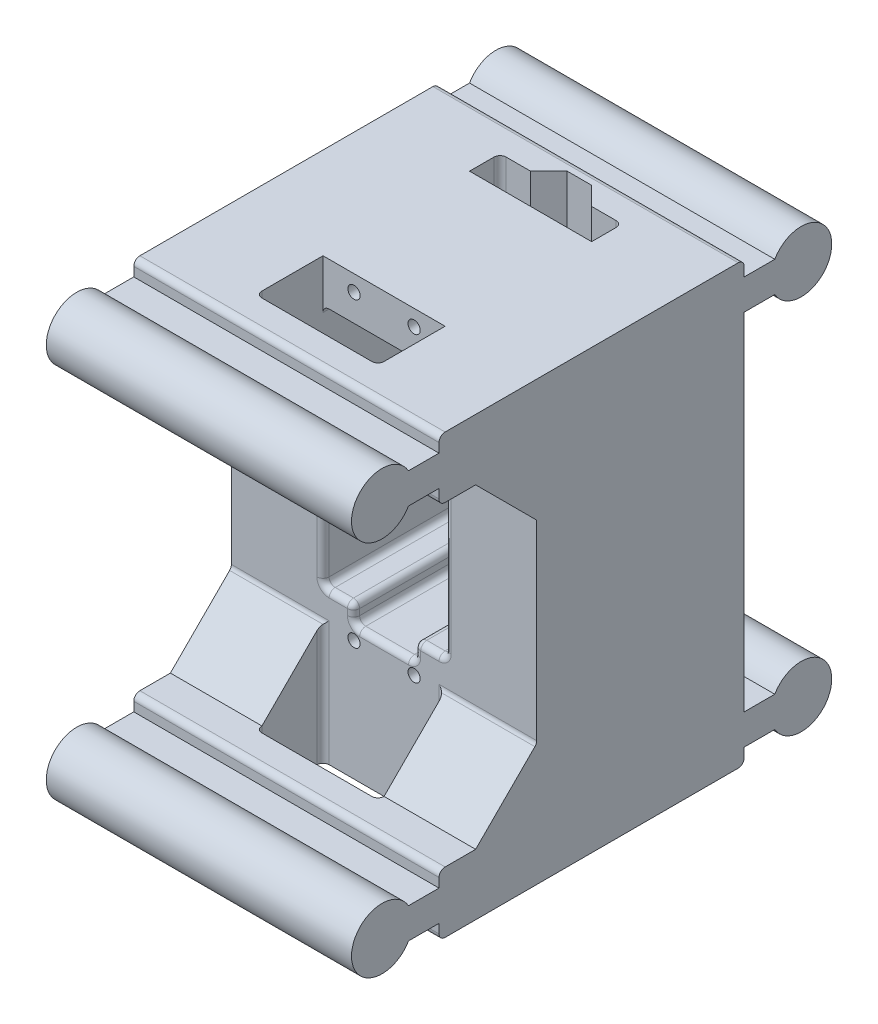
from build123d import *

# Parameters (mm, degrees)
ESBO_O2_W                = 20
ESBO_O2_H                = 40
RESSALTO_EXTRUS_O2_DEPTH = 29
ESBO_O3_W                = 15
ESBO_O3_H                = 10
RESSALTO_EXTRUS_O3_DEPTH = 16
ESBO_O4_W                = 5
ESBO_O4_H                = 10
RESSALTO_EXTRUS_O4_DEPTH = 20
ESBO_O5_W                = 50
ESBO_O5_H                = 71.7
RESSALTO_EXTRUS_O5_DEPTH = 5
RESSALTO_EXTRUS_O6_DEPTH = 50
ESBO_O9_W                = 10
ESBO_O9_H                = 6
CORTE_EXTRUS_O1_DEPTH    = 29
ESBO_O10_W               = 20
ESBO_O10_H               = 5
CORTE_EXTRUS_O2_DEPTH    = 7.05
ESBO_O11_W               = 10
ESBO_O11_H               = 50.05
CORTE_EXTRUS_O3_DEPTH    = 3
CHANFRO4_SIZE            = 3
ESBO_O12_R               = 1
CORTE_EXTRUS_O4_DEPTH    = 10
CHANFRO5_SIZE            = 10
FILETE2_R                = 1
ESBO_O19_R               = 2.05
CORTE_EXTRUS_O7_DEPTH    = 10


with BuildPart() as part:
    # Esboço2 → Ressalto-extrusão2 (new body)
    with BuildSketch(Plane.XY):
        Polygon((25, 0), (25, 7.05), (-25, 7.05), (-25, 0), (-25, -40), (-25, -64.65), (25, -64.65), (25, -40), align=None)
        with Locations((0, -20)):
            Rectangle(ESBO_O2_W, ESBO_O2_H, mode=Mode.SUBTRACT)
    extrude(amount=-RESSALTO_EXTRUS_O2_DEPTH)

    # Esboço3 → Ressalto-extrusão3 (add)
    with BuildSketch(Plane.XY):
        with Locations((17.5, 2.05)):
            Rectangle(ESBO_O3_W, ESBO_O3_H)
        with Locations((-17.5, 2.05)):
            Rectangle(ESBO_O3_W, ESBO_O3_H)
    ressalto_extrus_o3 = extrude(amount=RESSALTO_EXTRUS_O3_DEPTH)

    # Esboço4 → Ressalto-extrusão4 (add)
    with BuildSketch(Plane.ZY.offset(-10)):
        with Locations((13.5, 2.05)):
            Rectangle(ESBO_O4_W, ESBO_O4_H)
    ressalto_extrus_o4 = extrude(amount=RESSALTO_EXTRUS_O4_DEPTH)

    # Esboço5 → Ressalto-extrusão5 (add)
    with BuildSketch(Plane(origin=(0, 0, -29), x_dir=(-1, 0, 0), z_dir=(0, 0, -1))):
        with Locations((0, -28.8)):
            Rectangle(ESBO_O5_W, ESBO_O5_H)
    extrude(amount=RESSALTO_EXTRUS_O5_DEPTH)

    # Esboço6 → Ressalto-extrusão6 (add)
    with BuildSketch(Plane.ZY.offset(25)):
        with BuildLine():
            Line((16, 4.55), (21, 4.55))
            ThreePointArc((21, 4.55), (30.330127019, 2.05), (21, -0.45))
            Line((21, -0.45), (16, -0.45))
            Line((16, -0.45), (16, 4.55))
        make_face()
        with BuildLine():
            Line((-34, 4.55), (-34, -0.45))
            Line((-34, -0.45), (-39, -0.45))
            ThreePointArc((-39, -0.45), (-48.330127019, 2.05), (-39, 4.55))
            Line((-39, 4.55), (-34, 4.55))
        make_face()
    ressalto_extrus_o6 = extrude(amount=-RESSALTO_EXTRUS_O6_DEPTH)

    # Espelhar2: Ressalto-extrusão3, Ressalto-extrusão4, Ressalto-extrusão6 across plane
    add(ressalto_extrus_o3.mirror(Plane(origin=(0, -28.8, 0), x_dir=(0, 0, 1), z_dir=(0, -1, 0))))
    add(ressalto_extrus_o4.mirror(Plane(origin=(0, -28.8, 0), x_dir=(0, 0, 1), z_dir=(0, -1, 0))))
    add(ressalto_extrus_o6.mirror(Plane(origin=(0, -28.8, 0), x_dir=(0, 0, 1), z_dir=(0, -1, 0))))

    # Esboço9 → Corte-extrusão1 (cut)
    with BuildSketch(Plane.XY):
        with Locations((0, -40)):
            Rectangle(ESBO_O9_W, ESBO_O9_H)
    extrude(amount=-CORTE_EXTRUS_O1_DEPTH, mode=Mode.SUBTRACT)

    # Esboço10 → Corte-extrusão2 (cut)
    with BuildSketch(Plane.XZ):
        with Locations((0, -26.5)):
            Rectangle(ESBO_O10_W, ESBO_O10_H)
    extrude(amount=-CORTE_EXTRUS_O2_DEPTH, mode=Mode.SUBTRACT)

    # Esboço11 → Corte-extrusão3 (cut)
    with BuildSketch(Plane.XY.offset(-29)):
        with Locations((0, -17.975)):
            Rectangle(ESBO_O11_W, ESBO_O11_H)
    extrude(amount=-CORTE_EXTRUS_O3_DEPTH, mode=Mode.SUBTRACT)

    # Chanfro4
    chanfro4_edges = [part.edges().sort_by_distance(p)[0] for p in [
        (-5, -17.975, -32),
        (5, -17.975, -32),
    ]]
    chamfer(chanfro4_edges, length=CHANFRO4_SIZE)

    # Esboço12 → Corte-extrusão4 (cut)
    with BuildSketch(Plane.XY):
        with Locations((-4.925, 4.42)):
            Circle(ESBO_O12_R)
        with Locations((4.925, 4.42)):
            Circle(ESBO_O12_R)
        with Locations((4.925, -45)):
            Circle(ESBO_O12_R)
        with Locations((-4.925, -45)):
            Circle(ESBO_O12_R)
    extrude(amount=-CORTE_EXTRUS_O4_DEPTH, mode=Mode.SUBTRACT)

    # Chanfro5
    chanfro5_edges = [part.edges().sort_by_distance(p)[0] for p in [
        (17.5, -54.65, 0),
        (-17.5, -54.65, 0),
        (17.5, -2.95, 0),
        (-17.5, -2.95, 0),
    ]]
    chamfer(chanfro5_edges, length=CHANFRO5_SIZE)

    # Filete2
    # the kernel refuses this fillet: 1 mm, written as the material it adds along each edge
    with BuildSketch(Plane(origin=(10, -64.65, 0), x_dir=(0, 0, 1), z_dir=(0, 1, 0))) as filete2_piece_1_section:
        with BuildLine():
            CenterArc((FILETE2_R, -FILETE2_R), FILETE2_R, 90, 90)
            Line((0, -FILETE2_R), (0, 0))
            Line((0, 0), (FILETE2_R, 0))
        make_face()
    filete2_piece_1 = extrude(amount=22.5, mode=Mode.PRIVATE)
    filete2_piece_1 = split(filete2_piece_1, bisect_by=Plane(origin=(9.772216332, -49.818033507, 5.168033507), z_dir=(0, -0.7071067811865476, -0.7071067811865476)), keep=Keep.TOP, mode=Mode.PRIVATE)
    add(filete2_piece_1)
    with BuildSketch(Plane(origin=(-10, -42.15, 0), x_dir=(0, 0, 1), z_dir=(0, -1, 0))) as filete2_piece_2_section:
        with BuildLine():
            CenterArc((FILETE2_R, -FILETE2_R), FILETE2_R, 90, 90)
            Line((0, -FILETE2_R), (0, 0))
            Line((0, 0), (FILETE2_R, 0))
        make_face()
    filete2_piece_2 = extrude(amount=22.5, mode=Mode.PRIVATE)
    filete2_piece_2 = split(filete2_piece_2, bisect_by=Plane(origin=(-9.772216332, -49.818033507, 5.168033507), z_dir=(0, -0.7071067811865476, -0.7071067811865476)), keep=Keep.TOP, mode=Mode.PRIVATE)
    add(filete2_piece_2)
    with BuildSketch(Plane(origin=(10, -64.65, 11), x_dir=(0, 0, -1), z_dir=(0, 1, 0)), Plane(origin=(-10, -64.65, 11), x_dir=(1, 0, 0), z_dir=(0, 1, 0)), Plane(origin=(-10, 7.05, 11), x_dir=(0, 0, -1), z_dir=(0, -1, 0))) as filete2_piece_3:
        with BuildLine():
            CenterArc((FILETE2_R, FILETE2_R), FILETE2_R, 180, 90)
            Line((0, FILETE2_R), (0, 0))
            Line((0, 0), (FILETE2_R, 0))
        make_face()
    extrude(amount=10)
    with BuildSketch(Plane(origin=(-10, 0, 0), x_dir=(1, 0, 0), z_dir=(0, 0, -1)), Plane(origin=(10, 0, 0), x_dir=(0, -1, 0), z_dir=(0, 0, -1))) as filete2_piece_4:
        with BuildLine():
            CenterArc((FILETE2_R, FILETE2_R), FILETE2_R, 180, 90)
            Line((0, FILETE2_R), (0, 0))
            Line((0, 0), (FILETE2_R, 0))
        make_face()
    extrude(amount=24)
    with BuildSketch(Plane(origin=(5, -43, 0), x_dir=(0, 1, 0), z_dir=(0, 0, -1)), Plane(origin=(-5, -43, 0), x_dir=(1, 0, 0), z_dir=(0, 0, -1)), Plane(origin=(10, -40, 0), x_dir=(0, 1, 0), z_dir=(0, 0, -1))) as filete2_piece_5:
        with BuildLine():
            CenterArc((FILETE2_R, -FILETE2_R), FILETE2_R, 90, 90)
            Line((0, -FILETE2_R), (0, 0))
            Line((0, 0), (FILETE2_R, 0))
        make_face()
    extrude(amount=31.5)
    with BuildSketch(Plane(origin=(10, 7.05, -29), x_dir=(0, 0, 1), z_dir=(0, -1, 0)), Plane(origin=(-10, -42.5, -29), x_dir=(0, 0, 1), z_dir=(0, 1, 0))) as filete2_piece_6:
        with BuildLine():
            CenterArc((FILETE2_R, FILETE2_R), FILETE2_R, 180, 90)
            Line((0, FILETE2_R), (0, 0))
            Line((0, 0), (FILETE2_R, 0))
        make_face()
    extrude(amount=49.55)
    with BuildSketch(Plane(origin=(25, -44.65, 0), x_dir=(0, -0.7071067811865505, 0.7071067811865446), z_dir=(-1, 0, 0))) as filete2_piece_7:
        with BuildLine():
            CenterArc((FILETE2_R * 0.414213562373, FILETE2_R), FILETE2_R, 225, 45)
            Line((-FILETE2_R * 0.292893218813, FILETE2_R * 0.292893218813), (0, 0))
            Line((0, 0), (FILETE2_R * 0.414213562373, 0))
        make_face()
    extrude(amount=15)
    with BuildSketch(Plane(origin=(-10, -40, 0), x_dir=(0, 1, 0), z_dir=(0, 0, -1))) as filete2_piece_8:
        with BuildLine():
            CenterArc((FILETE2_R, FILETE2_R), FILETE2_R, 180, 90)
            Line((0, FILETE2_R), (0, 0))
            Line((0, 0), (FILETE2_R, 0))
        make_face()
    extrude(amount=31.5)
    with BuildSketch(Plane(origin=(-25, -44.65, 0), x_dir=(0, -0.7071067811865505, 0.7071067811865446), z_dir=(1, 0, 0))) as filete2_piece_9:
        with BuildLine():
            CenterArc((FILETE2_R * 0.414213562373, -FILETE2_R), FILETE2_R, 90, 45)
            Line((-FILETE2_R * 0.292893218813, -FILETE2_R * 0.292893218813), (0, 0))
            Line((0, 0), (FILETE2_R * 0.414213562373, 0))
        make_face()
    extrude(amount=15)
    with BuildSketch(Plane(origin=(10, 7.05, 11), x_dir=(0, 0, -1), z_dir=(0, -1, 0))) as filete2_piece_10:
        with BuildLine():
            CenterArc((FILETE2_R, -FILETE2_R), FILETE2_R, 90, 90)
            Line((0, -FILETE2_R), (0, 0))
            Line((0, 0), (FILETE2_R, 0))
        make_face()
    extrude(amount=10)
    with BuildSketch(Plane(origin=(25, -44.65, 0), x_dir=(0, -0.7071067811865505, 0.7071067811865446), z_dir=(-1, 0, 0))) as filete2_piece_11a_section:
        with BuildLine():
            CenterArc((FILETE2_R * 0.414213562373, FILETE2_R), FILETE2_R, 225, 45)
            Line((-FILETE2_R * 0.292893218813, FILETE2_R * 0.292893218813), (0, 0))
            Line((0, 0), (FILETE2_R * 0.414213562373, 0))
        make_face()
    filete2_piece_11a = extrude(amount=16.035533906, mode=Mode.PRIVATE)
    filete2_piece_11a = split(filete2_piece_11a, bisect_by=Plane(origin=(10, -44.624397401, 0.061810142), z_dir=(-1, 0, 0)), keep=Keep.TOP, mode=Mode.PRIVATE)
    with BuildSketch(Plane(origin=(10, -64.65, 0), x_dir=(0, 0, 1), z_dir=(0, 1, 0))) as filete2_piece_11b_section:
        with BuildLine():
            CenterArc((FILETE2_R, -FILETE2_R), FILETE2_R, 90, 90)
            Line((0, -FILETE2_R), (0, 0))
            Line((0, 0), (FILETE2_R, 0))
        make_face()
    filete2_piece_11b = extrude(amount=22.5, mode=Mode.PRIVATE)
    filete2_piece_11b = split(filete2_piece_11b, bisect_by=Plane(origin=(9.783675587, -44.207581525, -0.442418475), z_dir=(0, 0.7071067811865476, 0.7071067811865476)), keep=Keep.TOP, mode=Mode.PRIVATE)
    filete2_piece_11 = filete2_piece_11a & filete2_piece_11b
    add(filete2_piece_11)
    with BuildSketch(Plane(origin=(-10, -42.15, 0), x_dir=(0, 0, 1), z_dir=(0, -1, 0))) as filete2_piece_12a_section:
        with BuildLine():
            CenterArc((FILETE2_R, -FILETE2_R), FILETE2_R, 90, 90)
            Line((0, -FILETE2_R), (0, 0))
            Line((0, 0), (FILETE2_R, 0))
        make_face()
    filete2_piece_12a = extrude(amount=22.5, mode=Mode.PRIVATE)
    filete2_piece_12a = split(filete2_piece_12a, bisect_by=Plane(origin=(-9.783675587, -44.207581525, -0.442418475), z_dir=(0, 0.7071067811865476, 0.7071067811865476)), keep=Keep.TOP, mode=Mode.PRIVATE)
    with BuildSketch(Plane(origin=(-25, -44.65, 0), x_dir=(0, -0.7071067811865505, 0.7071067811865446), z_dir=(1, 0, 0))) as filete2_piece_12b_section:
        with BuildLine():
            CenterArc((FILETE2_R * 0.414213562373, -FILETE2_R), FILETE2_R, 90, 45)
            Line((-FILETE2_R * 0.292893218813, -FILETE2_R * 0.292893218813), (0, 0))
            Line((0, 0), (FILETE2_R * 0.414213562373, 0))
        make_face()
    filete2_piece_12b = extrude(amount=16.035533906, mode=Mode.PRIVATE)
    filete2_piece_12b = split(filete2_piece_12b, bisect_by=Plane(origin=(-10, -44.624397401, 0.061810142), z_dir=(1, 0, 0)), keep=Keep.TOP, mode=Mode.PRIVATE)
    filete2_piece_12 = filete2_piece_12a & filete2_piece_12b
    add(filete2_piece_12)
    # the kernel refuses this fillet: 1 mm, written as the material it takes off along each edge
    with BuildSketch(Plane(origin=(-27.5, -64.65, 16), x_dir=(0, 0, -1), z_dir=(1, 0, 0)), Plane(origin=(-27.5, -54.65, 16), x_dir=(0, -1, 0), z_dir=(1, 0, 0)), Plane(origin=(-27.5, -2.95, 16), x_dir=(0, 0, -1), z_dir=(1, 0, 0)), Plane(origin=(-27.5, 7.05, 16), x_dir=(0, -1, 0), z_dir=(1, 0, 0))) as filete2_2_piece_1:
        with BuildLine():
            CenterArc((FILETE2_R, FILETE2_R), FILETE2_R, 180, 90)
            Line((0, FILETE2_R), (0, 0))
            Line((0, 0), (FILETE2_R, 0))
        make_face()
    extrude(amount=55, mode=Mode.SUBTRACT)
    with BuildSketch(Plane(origin=(5, -40, -29), x_dir=(1, 0, 0), z_dir=(0, 0, 1))) as filete2_2_piece_2_section:
        with BuildLine():
            CenterArc((FILETE2_R, -FILETE2_R), FILETE2_R, 90, 90)
            Line((0, -FILETE2_R), (0, 0))
            Line((0, 0), (FILETE2_R, 0))
        make_face()
    filete2_2_piece_2 = extrude(amount=31.5, mode=Mode.PRIVATE)
    filete2_2_piece_2 = split(filete2_2_piece_2, bisect_by=Plane(origin=(5.322588538, -40.106472513, -28.677411462), z_dir=(0.7071067811865476, 0, -0.7071067811865476)), keep=Keep.TOP, mode=Mode.PRIVATE)
    add(filete2_2_piece_2, mode=Mode.SUBTRACT)
    with BuildSketch(Plane(origin=(5, -40, -29), x_dir=(1, 0, 0), z_dir=(0, 0, 1))) as filete2_2_piece_3_section:
        with BuildLine():
            CenterArc((FILETE2_R, -FILETE2_R), FILETE2_R, 90, 90)
            Line((0, -FILETE2_R), (0, 0))
            Line((0, 0), (FILETE2_R, 0))
        make_face()
    filete2_2_piece_3 = extrude(amount=31.5, mode=Mode.PRIVATE)
    filete2_2_piece_3 = split(filete2_2_piece_3, bisect_by=Plane(origin=(13.043887761, -40.227266345, -20.956112239), z_dir=(-0.7071067811865476, 0, 0.7071067811865476)), keep=Keep.TOP, mode=Mode.PRIVATE)
    add(filete2_2_piece_3, mode=Mode.SUBTRACT)
    with BuildSketch(Plane(origin=(-5, -40, 2.5), x_dir=(-1, 0, 0), z_dir=(0, 0, -1))) as filete2_2_piece_4_section:
        with BuildLine():
            CenterArc((FILETE2_R, -FILETE2_R), FILETE2_R, 90, 90)
            Line((0, -FILETE2_R), (0, 0))
            Line((0, 0), (FILETE2_R, 0))
        make_face()
    filete2_2_piece_4 = extrude(amount=31.5, mode=Mode.PRIVATE)
    filete2_2_piece_4 = split(filete2_2_piece_4, bisect_by=Plane(origin=(-13.043887761, -40.227266345, -20.956112239), z_dir=(0.7071067811865476, 0, 0.7071067811865476)), keep=Keep.TOP, mode=Mode.PRIVATE)
    add(filete2_2_piece_4, mode=Mode.SUBTRACT)
    with BuildSketch(Plane(origin=(-5, -40, 2.5), x_dir=(-1, 0, 0), z_dir=(0, 0, -1))) as filete2_2_piece_5_section:
        with BuildLine():
            CenterArc((FILETE2_R, -FILETE2_R), FILETE2_R, 90, 90)
            Line((0, -FILETE2_R), (0, 0))
            Line((0, 0), (FILETE2_R, 0))
        make_face()
    filete2_2_piece_5 = extrude(amount=31.5, mode=Mode.PRIVATE)
    filete2_2_piece_5 = split(filete2_2_piece_5, bisect_by=Plane(origin=(-5.322588538, -40.106472513, -28.677411462), z_dir=(-0.7071067811865476, 0, -0.7071067811865476)), keep=Keep.TOP, mode=Mode.PRIVATE)
    add(filete2_2_piece_5, mode=Mode.SUBTRACT)
    with BuildSketch(Plane(origin=(-27.5, 7.05, -34), x_dir=(0, -1, 0), z_dir=(1, 0, 0)), Plane(origin=(27.5, -64.65, -34), x_dir=(0, 1, 0), z_dir=(-1, 0, 0))) as filete2_2_piece_6:
        with BuildLine():
            CenterArc((FILETE2_R, -FILETE2_R), FILETE2_R, 90, 90)
            Line((0, -FILETE2_R), (0, 0))
            Line((0, 0), (FILETE2_R, 0))
        make_face()
    extrude(amount=55, mode=Mode.SUBTRACT)
    # the kernel refuses this fillet: 1 mm, written as the material it takes off along each edge
    with BuildSketch(Plane(origin=(9, -40, 0), x_dir=(0, 0, -1), z_dir=(-1, 0, 0)), Plane(origin=(-6, -40, 0), x_dir=(0, 0, -1), z_dir=(-1, 0, 0))) as filete2_3_piece_1:
        with BuildLine():
            CenterArc((FILETE2_R, FILETE2_R), FILETE2_R, 180, 90)
            Line((0, FILETE2_R), (0, 0))
            Line((0, 0), (FILETE2_R, 0))
        make_face()
    extrude(amount=3, mode=Mode.SUBTRACT)
    with BuildSketch(Plane(origin=(5, -41, 0), x_dir=(0, 0, -1), z_dir=(0, -1, 0)), Plane(origin=(-5, -42, 0), x_dir=(0, 0, -1), z_dir=(0, 1, 0))) as filete2_3_piece_2:
        with BuildLine():
            CenterArc((FILETE2_R, FILETE2_R), FILETE2_R, 180, 90)
            Line((0, FILETE2_R), (0, 0))
            Line((0, 0), (FILETE2_R, 0))
        make_face()
    extrude(amount=1, mode=Mode.SUBTRACT)
    with BuildSketch(Plane(origin=(4, -43, 0), x_dir=(0, 0, -1), z_dir=(-1, 0, 0))) as filete2_3_piece_3:
        with BuildLine():
            CenterArc((FILETE2_R, FILETE2_R), FILETE2_R, 180, 90)
            Line((0, FILETE2_R), (0, 0))
            Line((0, 0), (FILETE2_R, 0))
        make_face()
    extrude(amount=8, mode=Mode.SUBTRACT)
    with BuildSketch(Plane(origin=(-10, -39, 0), x_dir=(0, 0, -1), z_dir=(0, 1, 0))) as filete2_3_piece_4_section:
        with BuildLine():
            CenterArc((FILETE2_R, FILETE2_R), FILETE2_R, 180, 90)
            Line((0, FILETE2_R), (0, 0))
            Line((0, 0), (FILETE2_R, 0))
        make_face()
    filete2_3_piece_4 = extrude(amount=28.55, mode=Mode.PRIVATE)
    filete2_3_piece_4 = split(filete2_3_piece_4, bisect_by=Plane(origin=(-10.227458355, -19.630946506, -6.680946506), z_dir=(0, -0.7071067811865476, 0.7071067811865476)), keep=Keep.TOP, mode=Mode.PRIVATE)
    add(filete2_3_piece_4, mode=Mode.SUBTRACT)
    with BuildSketch(Plane(origin=(10, -10.45, 0), x_dir=(0, 0, -1), z_dir=(0, -1, 0))) as filete2_3_piece_5_section:
        with BuildLine():
            CenterArc((FILETE2_R, FILETE2_R), FILETE2_R, 180, 90)
            Line((0, FILETE2_R), (0, 0))
            Line((0, 0), (FILETE2_R, 0))
        make_face()
    filete2_3_piece_5 = extrude(amount=28.55, mode=Mode.PRIVATE)
    filete2_3_piece_5 = split(filete2_3_piece_5, bisect_by=Plane(origin=(10.227458355, -19.630946506, -6.680946506), z_dir=(0, -0.7071067811865476, 0.7071067811865476)), keep=Keep.TOP, mode=Mode.PRIVATE)
    add(filete2_3_piece_5, mode=Mode.SUBTRACT)
    with BuildSketch(Plane(origin=(9, -39, 0), x_dir=(1, 0, 0), z_dir=(0, 1, 0))) as filete2_3_piece_6:
        with BuildLine():
            CenterArc((1 + FILETE2_R, FILETE2_R), FILETE2_R, 180, 90)
            Line((1 + FILETE2_R, 0), (1, 0))
            Line((1, 0), (1, FILETE2_R))
        make_face()
    revolve(axis=Axis((9, -39, 0), (0, 0, -1)), revolution_arc=90, mode=Mode.SUBTRACT)
    with BuildSketch(Plane(origin=(-6, -41, 0), x_dir=(1, 0, 0), z_dir=(0, -1, 0))) as filete2_3_piece_7:
        with BuildLine():
            CenterArc((1 - FILETE2_R, -FILETE2_R), FILETE2_R, 0, 90)
            Line((1 - FILETE2_R, 0), (1, 0))
            Line((1, 0), (1, -FILETE2_R))
        make_face()
    revolve(axis=Axis((-6, -41, 0), (0, 0, 1)), revolution_arc=90, mode=Mode.SUBTRACT)
    with BuildSketch(Plane(origin=(-9, -39, 0), x_dir=(-1, 0, 0), z_dir=(0, 1, 0))) as filete2_3_piece_8:
        with BuildLine():
            CenterArc((1 + FILETE2_R, -FILETE2_R), FILETE2_R, 90, 90)
            Line((1 + FILETE2_R, 0), (1, 0))
            Line((1, 0), (1, -FILETE2_R))
        make_face()
    revolve(axis=Axis((-9, -39, 0), (0, 0, 1)), revolution_arc=90, mode=Mode.SUBTRACT)
    with BuildSketch(Plane(origin=(4, -42, 0), x_dir=(1, 0, 0), z_dir=(0, 1, 0))) as filete2_3_piece_9:
        with BuildLine():
            CenterArc((1 + FILETE2_R, FILETE2_R), FILETE2_R, 180, 90)
            Line((1 + FILETE2_R, 0), (1, 0))
            Line((1, 0), (1, FILETE2_R))
        make_face()
    revolve(axis=Axis((4, -42, 0), (0, 0, -1)), revolution_arc=90, mode=Mode.SUBTRACT)
    with BuildSketch(Plane(origin=(-4, -42, 0), x_dir=(0, -1, 0), z_dir=(1, 0, 0))) as filete2_3_piece_10:
        with BuildLine():
            CenterArc((1 + FILETE2_R, FILETE2_R), FILETE2_R, 180, 90)
            Line((1 + FILETE2_R, 0), (1, 0))
            Line((1, 0), (1, FILETE2_R))
        make_face()
    revolve(axis=Axis((-4, -42, 0), (0, 0, -1)), revolution_arc=90, mode=Mode.SUBTRACT)
    with BuildSketch(Plane(origin=(6, -41, 0), x_dir=(-1, 0, 0), z_dir=(0, -1, 0))) as filete2_3_piece_11:
        with BuildLine():
            CenterArc((1 - FILETE2_R, FILETE2_R), FILETE2_R, 270, 90)
            Line((1 - FILETE2_R, 0), (1, 0))
            Line((1, 0), (1, FILETE2_R))
        make_face()
    revolve(axis=Axis((6, -41, 0), (0, 0, -1)), revolution_arc=90, mode=Mode.SUBTRACT)

    # Esboço19 → Corte-extrusão7 (cut)
    with BuildSketch(Plane.ZY.offset(25)):
        with Locations(Location((-26, 2.05, 0), (0, 0, 270))):
            Circle(ESBO_O19_R)
        with Locations(Location((-6, 2.05, 0), (0, 0, 270))):
            Circle(ESBO_O19_R)
    extrude(amount=-CORTE_EXTRUS_O7_DEPTH, mode=Mode.SUBTRACT)


solid = part.part
